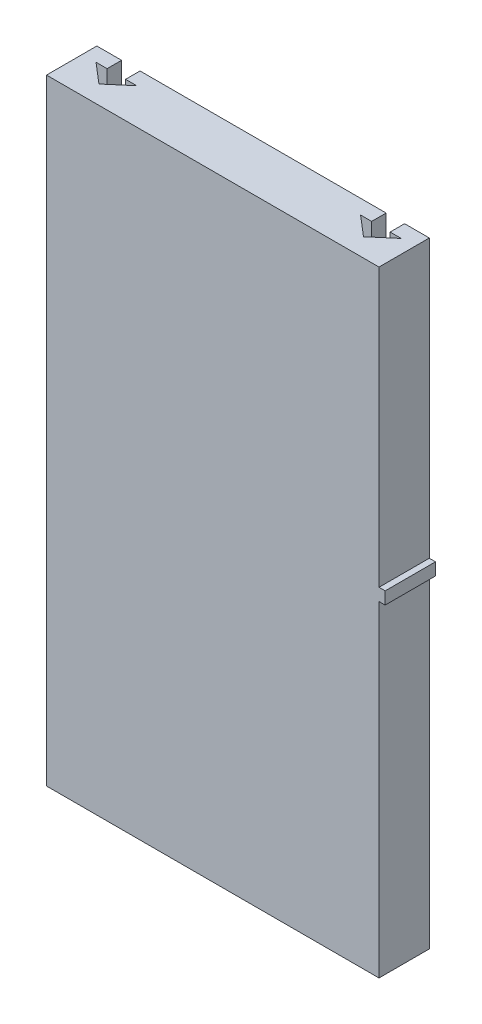
from build123d import *

# Parameters (mm, degrees)
SALIENTE_EXTRUIR1_DEPTH = 100
SKETCH1_R               = 19
CUT_EXTRUDE1_DEPTH      = 3.4
SKETCH3_W               = 6.43960336
SKETCH3_H               = 19.938110376
CUT_EXTRUDE3_DEPTH      = 12
CUT_EXTRUDE4_DEPTH      = 3.3
SKETCH4_W               = 8.173615483
SKETCH4_H               = 2
BOSS_EXTRUDE1_DEPTH     = 1


with BuildPart() as part:
    # Croquis1 → Saliente-Extruir1 (new body)
    with BuildSketch(Plane(origin=(0, 0, 0), x_dir=(1, 0, 0), z_dir=(0, 1, 0))):
        Polygon((-27, 10.330876659), (-27, 2.157261176), (27, 2.157261176), (27, 10.330876659), (22.982268067, 10.330876659), (22.982268067, 7.980876659), (24.782268067, 7.980876659), (21.482268067, 5.157261176), (18.182268067, 7.980876659), (19.982268067, 7.980876659), (19.982268067, 10.330876659), (-19, 10.330876659), (-19.982268067, 10.330876659), (-19.982268067, 7.980876659), (-18.182268067, 7.980876659), (-21.482268067, 5.157261176), (-24.782268067, 7.980876659), (-22.982268067, 7.980876659), (-22.982268067, 10.330876659), align=None)
    extrude(amount=SALIENTE_EXTRUIR1_DEPTH)

    # Sketch1 → Cut-Extrude1 (cut)
    with BuildSketch(Plane(origin=(0, 0, -10.330876659), x_dir=(-1, 0, 0), z_dir=(0, 0, -1))):
        with Locations((0, 68.083495878)):
            Circle(SKETCH1_R)
    extrude(amount=-CUT_EXTRUDE1_DEPTH, mode=Mode.SUBTRACT)

    # Sketch3 → Cut-Extrude3 (cut)
    with BuildSketch(Plane.ZY.offset(27)):
        with Locations((-6.403920089, 60.498229031)):
            Rectangle(SKETCH3_W, SKETCH3_H)
    extrude(amount=-CUT_EXTRUDE3_DEPTH, mode=Mode.SUBTRACT)

    # Sketch2 → Cut-Extrude4 (cut)
    with BuildSketch(Plane(origin=(0, 0, -10.330876659), x_dir=(-1, 0, 0), z_dir=(0, 0, -1))):
        Polygon((28.195653607, 86.854592918), (1.267428106, 86.854592918), (-2.043789717, 86.973252986), (-2.043789717, 50.812824037), (-0.761293433, 48.752476042), (28.195653607, 48.752476042), align=None)
    extrude(amount=-CUT_EXTRUDE4_DEPTH, mode=Mode.SUBTRACT)

    # Sketch4 → Boss-Extrude1 (add)
    with BuildSketch(Plane(origin=(27, 0, 0), x_dir=(0, 0, -1), z_dir=(1, 0, 0))):
        with Locations((6.244068918, 53.95341441)):
            Rectangle(SKETCH4_W, SKETCH4_H)
    extrude(amount=BOSS_EXTRUDE1_DEPTH)


solid = part.part
